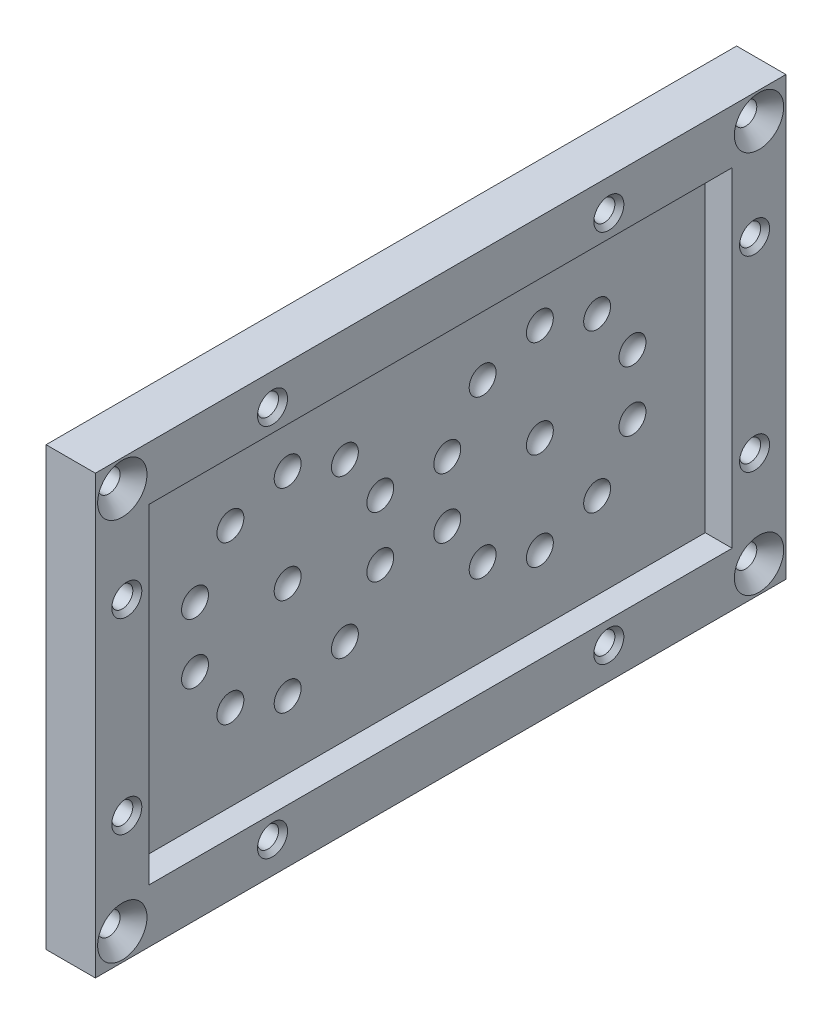
from build123d import *

# Parameters (mm, degrees)
SKETCH1_W           = 130
SKETCH1_H           = 73.5
BOSS_EXTRUDE1_DEPTH = 5
SKETCH2_R           = 3
CUT_EXTRUDE1_DEPTH  = 2
FILLET1_R           = 3.23
SKETCH3_W           = 10
SKETCH3_H           = 73.5
BOSS_EXTRUDE2_DEPTH = 11
SKETCH4_R           = 2.35
CUT_EXTRUDE2_DEPTH  = 8
CHAMFER1_SIZE       = 1
SKETCH5_W           = 11
SKETCH5_H           = 150
BOSS_EXTRUDE3_DEPTH = 2
SKETCH6_W           = 11
SKETCH6_H           = 150
BOSS_EXTRUDE4_DEPTH = 2
SKETCH7_W           = 11
SKETCH7_H           = 97.5
BOSS_EXTRUDE5_DEPTH = 2
SKETCH8_W           = 11
SKETCH8_H           = 97.5
BOSS_EXTRUDE6_DEPTH = 2
SKETCH12_R          = 2.5
CUT_EXTRUDE3_DEPTH  = 92.796309839
CHAMFER2_SIZE       = 3


with BuildPart() as part:
    # Sketch1 → Boss-Extrude1 (new body)
    with BuildSketch(Plane(origin=(0, 0, 0), x_dir=(0, 0, -1), z_dir=(1, 0, 0))):
        Rectangle(SKETCH1_W, SKETCH1_H)
    extrude(amount=BOSS_EXTRUDE1_DEPTH)

    # Sketch2 → Cut-Extrude1 (cut)
    with BuildSketch(Plane(origin=(5, 0, 0), x_dir=(0, 0, -1), z_dir=(1, 0, 0))):
        with Locations((28.125, -21.718)):
            Circle(SKETCH2_R)
        with Locations((15.359479891, -17.570231084)):
            Circle(SKETCH2_R)
        with Locations((7.469954579, -6.711231084)):
            Circle(SKETCH2_R)
        with Locations((7.469954579, 6.711231084)):
            Circle(SKETCH2_R)
        with Locations((15.359479891, 17.570231084)):
            Circle(SKETCH2_R)
        with Locations((28.125, 21.718)):
            Circle(SKETCH2_R)
        with Locations((40.890520109, 17.570231084)):
            Circle(SKETCH2_R)
        with Locations((48.780045421, 6.711231084)):
            Circle(SKETCH2_R)
        with Locations((48.780045421, -6.711231084)):
            Circle(SKETCH2_R)
        with Locations((40.890520109, -17.570231084)):
            Circle(SKETCH2_R)
        with Locations(Location((-7.469954579, -6.711231084, 0), (0, 0, 180))):
            Circle(SKETCH2_R)
        with Locations(Location((-15.359479891, -17.570231084, 0), (0, 0, 180))):
            Circle(SKETCH2_R)
        with Locations(Location((-28.125, -21.718, 0), (0, 0, 180))):
            Circle(SKETCH2_R)
        with Locations(Location((-40.890520109, -17.570231084, 0), (0, 0, 180))):
            Circle(SKETCH2_R)
        with Locations(Location((-48.780045421, -6.711231084, 0), (0, 0, 180))):
            Circle(SKETCH2_R)
        with Locations(Location((-48.780045421, 6.711231084, 0), (0, 0, 180))):
            Circle(SKETCH2_R)
        with Locations(Location((-40.890520109, 17.570231084, 0), (0, 0, 180))):
            Circle(SKETCH2_R)
        with Locations(Location((-28.125, 21.718, 0), (0, 0, 180))):
            Circle(SKETCH2_R)
        with Locations(Location((-15.359479891, 17.570231084, 0), (0, 0, 180))):
            Circle(SKETCH2_R)
        with Locations(Location((-7.469954579, 6.711231084, 0), (0, 0, 180))):
            Circle(SKETCH2_R)
        with Locations((28.125, 0)):
            Circle(SKETCH2_R)
        with Locations(Location((-28.125, 0, 0), (0, 0, 180))):
            Circle(SKETCH2_R)
    extrude(amount=-CUT_EXTRUDE1_DEPTH, mode=Mode.SUBTRACT)

    # Fillet1
    # the kernel refuses this fillet: 3.23 mm, written as the material it adds along each edge
    with BuildSketch(Plane(origin=(3, 17.570231084, 40.890520109), x_dir=(0, 0, 1), z_dir=(0, 1, 0))) as fillet1_piece_1:
        with BuildLine():
            CenterArc((0.013363095, 3.23), FILLET1_R, 270, 67.616447755)
            Line((0.013363095, 0), (0.013363095, -0.0646))
            Line((0.013363095, -0.0646), (3, -0.0646))
            Line((3, -0.0646), (3.0646, 0))
            ThreePointArc((3.0646, 0), (3.0646, 1), (3.059732738, 1.9754))
            Line((3.059732738, 1.9754), (3, 2))
        make_face()
    revolve(axis=Axis((3, 17.570231084, 40.890520109), (1, 0, 0)))
    with BuildSketch(Plane(origin=(3, 6.711231084, 48.780045421), x_dir=(0, 0, 1), z_dir=(0, 1, 0))) as fillet1_piece_2:
        with BuildLine():
            CenterArc((0.013363095, 3.23), FILLET1_R, 270, 67.616447755)
            Line((0.013363095, 0), (0.013363095, -0.0646))
            Line((0.013363095, -0.0646), (3, -0.0646))
            Line((3, -0.0646), (3.0646, 0))
            ThreePointArc((3.0646, 0), (3.0646, 1), (3.059732738, 1.9754))
            Line((3.059732738, 1.9754), (3, 2))
        make_face()
    revolve(axis=Axis((3, 6.711231084, 48.780045421), (1, 0, 0)))
    with BuildSketch(Plane(origin=(3, -6.711231084, 48.780045421), x_dir=(0, 0, 1), z_dir=(0, 1, 0))) as fillet1_piece_3:
        with BuildLine():
            CenterArc((0.013363095, 3.23), FILLET1_R, 270, 67.616447755)
            Line((0.013363095, 0), (0.013363095, -0.0646))
            Line((0.013363095, -0.0646), (3, -0.0646))
            Line((3, -0.0646), (3.0646, 0))
            ThreePointArc((3.0646, 0), (3.0646, 1), (3.059732738, 1.9754))
            Line((3.059732738, 1.9754), (3, 2))
        make_face()
    revolve(axis=Axis((3, -6.711231084, 48.780045421), (1, 0, 0)))
    with BuildSketch(Plane(origin=(3, -17.570231084, 40.890520109), x_dir=(0, 0, 1), z_dir=(0, 1, 0))) as fillet1_piece_4:
        with BuildLine():
            CenterArc((0.013363095, 3.23), FILLET1_R, 270, 67.616447755)
            Line((0.013363095, 0), (0.013363095, -0.0646))
            Line((0.013363095, -0.0646), (3, -0.0646))
            Line((3, -0.0646), (3.0646, 0))
            ThreePointArc((3.0646, 0), (3.0646, 1), (3.059732738, 1.9754))
            Line((3.059732738, 1.9754), (3, 2))
        make_face()
    revolve(axis=Axis((3, -17.570231084, 40.890520109), (1, 0, 0)))
    with BuildSketch(Plane(origin=(3, -21.718, 28.125), x_dir=(0, 0, 1), z_dir=(0, 1, 0))) as fillet1_piece_5:
        with BuildLine():
            CenterArc((0.013363095, 3.23), FILLET1_R, 270, 67.616447755)
            Line((0.013363095, 0), (0.013363095, -0.0646))
            Line((0.013363095, -0.0646), (3, -0.0646))
            Line((3, -0.0646), (3.0646, 0))
            ThreePointArc((3.0646, 0), (3.0646, 1), (3.059732738, 1.9754))
            Line((3.059732738, 1.9754), (3, 2))
        make_face()
    revolve(axis=Axis((3, -21.718, 28.125), (1, 0, 0)))
    with BuildSketch(Plane(origin=(3, -17.570231084, 15.359479891), x_dir=(0, 0, 1), z_dir=(0, 1, 0))) as fillet1_piece_6:
        with BuildLine():
            CenterArc((0.013363095, 3.23), FILLET1_R, 270, 67.616447755)
            Line((0.013363095, 0), (0.013363095, -0.0646))
            Line((0.013363095, -0.0646), (3, -0.0646))
            Line((3, -0.0646), (3.0646, 0))
            ThreePointArc((3.0646, 0), (3.0646, 1), (3.059732738, 1.9754))
            Line((3.059732738, 1.9754), (3, 2))
        make_face()
    revolve(axis=Axis((3, -17.570231084, 15.359479891), (1, 0, 0)))
    with BuildSketch(Plane(origin=(3, -17.570231084, -40.890520109), x_dir=(0, 0, -1), z_dir=(0, -1, 0))) as fillet1_piece_7:
        with BuildLine():
            CenterArc((0.013363095, 3.23), FILLET1_R, 270, 67.616447755)
            Line((0.013363095, 0), (0.013363095, -0.0646))
            Line((0.013363095, -0.0646), (3, -0.0646))
            Line((3, -0.0646), (3.0646, 0))
            ThreePointArc((3.0646, 0), (3.0646, 1), (3.059732738, 1.9754))
            Line((3.059732738, 1.9754), (3, 2))
        make_face()
    revolve(axis=Axis((3, -17.570231084, -40.890520109), (1, 0, 0)))
    with BuildSketch(Plane(origin=(3, -6.711231084, -48.780045421), x_dir=(0, 0, -1), z_dir=(0, -1, 0))) as fillet1_piece_8:
        with BuildLine():
            CenterArc((0.013363095, 3.23), FILLET1_R, 270, 67.616447755)
            Line((0.013363095, 0), (0.013363095, -0.0646))
            Line((0.013363095, -0.0646), (3, -0.0646))
            Line((3, -0.0646), (3.0646, 0))
            ThreePointArc((3.0646, 0), (3.0646, 1), (3.059732738, 1.9754))
            Line((3.059732738, 1.9754), (3, 2))
        make_face()
    revolve(axis=Axis((3, -6.711231084, -48.780045421), (1, 0, 0)))
    with BuildSketch(Plane(origin=(3, 6.711231084, -7.469954579), x_dir=(0, 0, -1), z_dir=(0, -1, 0))) as fillet1_piece_9:
        with BuildLine():
            CenterArc((0.013363095, 3.23), FILLET1_R, 270, 67.616447755)
            Line((0.013363095, 0), (0.013363095, -0.0646))
            Line((0.013363095, -0.0646), (3, -0.0646))
            Line((3, -0.0646), (3.0646, 0))
            ThreePointArc((3.0646, 0), (3.0646, 1), (3.059732738, 1.9754))
            Line((3.059732738, 1.9754), (3, 2))
        make_face()
    revolve(axis=Axis((3, 6.711231084, -7.469954579), (1, 0, 0)))
    with BuildSketch(Plane(origin=(3, -6.711231084, -7.469954579), x_dir=(0, 0, -1), z_dir=(0, -1, 0))) as fillet1_piece_10:
        with BuildLine():
            CenterArc((0.013363095, 3.23), FILLET1_R, 270, 67.616447755)
            Line((0.013363095, 0), (0.013363095, -0.0646))
            Line((0.013363095, -0.0646), (3, -0.0646))
            Line((3, -0.0646), (3.0646, 0))
            ThreePointArc((3.0646, 0), (3.0646, 1), (3.059732738, 1.9754))
            Line((3.059732738, 1.9754), (3, 2))
        make_face()
    revolve(axis=Axis((3, -6.711231084, -7.469954579), (1, 0, 0)))
    with BuildSketch(Plane(origin=(3, -17.570231084, -15.359479891), x_dir=(0, 0, -1), z_dir=(0, -1, 0))) as fillet1_piece_11:
        with BuildLine():
            CenterArc((0.013363095, 3.23), FILLET1_R, 270, 67.616447755)
            Line((0.013363095, 0), (0.013363095, -0.0646))
            Line((0.013363095, -0.0646), (3, -0.0646))
            Line((3, -0.0646), (3.0646, 0))
            ThreePointArc((3.0646, 0), (3.0646, 1), (3.059732738, 1.9754))
            Line((3.059732738, 1.9754), (3, 2))
        make_face()
    revolve(axis=Axis((3, -17.570231084, -15.359479891), (1, 0, 0)))
    with BuildSketch(Plane(origin=(3, -6.711231084, 7.469954579), x_dir=(0, 0, 1), z_dir=(0, 1, 0))) as fillet1_piece_12:
        with BuildLine():
            CenterArc((0.013363095, 3.23), FILLET1_R, 270, 67.616447755)
            Line((0.013363095, 0), (0.013363095, -0.0646))
            Line((0.013363095, -0.0646), (3, -0.0646))
            Line((3, -0.0646), (3.0646, 0))
            ThreePointArc((3.0646, 0), (3.0646, 1), (3.059732738, 1.9754))
            Line((3.059732738, 1.9754), (3, 2))
        make_face()
    revolve(axis=Axis((3, -6.711231084, 7.469954579), (1, 0, 0)))
    with BuildSketch(Plane(origin=(3, 17.570231084, -15.359479891), x_dir=(0, 0, -1), z_dir=(0, -1, 0))) as fillet1_piece_13:
        with BuildLine():
            CenterArc((0.013363095, 3.23), FILLET1_R, 270, 67.616447755)
            Line((0.013363095, 0), (0.013363095, -0.0646))
            Line((0.013363095, -0.0646), (3, -0.0646))
            Line((3, -0.0646), (3.0646, 0))
            ThreePointArc((3.0646, 0), (3.0646, 1), (3.059732738, 1.9754))
            Line((3.059732738, 1.9754), (3, 2))
        make_face()
    revolve(axis=Axis((3, 17.570231084, -15.359479891), (1, 0, 0)))
    with BuildSketch(Plane(origin=(3, 21.718, -28.125), x_dir=(0, 0, -1), z_dir=(0, -1, 0))) as fillet1_piece_14:
        with BuildLine():
            CenterArc((0.013363095, 3.23), FILLET1_R, 270, 67.616447755)
            Line((0.013363095, 0), (0.013363095, -0.0646))
            Line((0.013363095, -0.0646), (3, -0.0646))
            Line((3, -0.0646), (3.0646, 0))
            ThreePointArc((3.0646, 0), (3.0646, 1), (3.059732738, 1.9754))
            Line((3.059732738, 1.9754), (3, 2))
        make_face()
    revolve(axis=Axis((3, 21.718, -28.125), (1, 0, 0)))
    with BuildSketch(Plane(origin=(3, 17.570231084, -40.890520109), x_dir=(0, 0, -1), z_dir=(0, -1, 0))) as fillet1_piece_15:
        with BuildLine():
            CenterArc((0.013363095, 3.23), FILLET1_R, 270, 67.616447755)
            Line((0.013363095, 0), (0.013363095, -0.0646))
            Line((0.013363095, -0.0646), (3, -0.0646))
            Line((3, -0.0646), (3.0646, 0))
            ThreePointArc((3.0646, 0), (3.0646, 1), (3.059732738, 1.9754))
            Line((3.059732738, 1.9754), (3, 2))
        make_face()
    revolve(axis=Axis((3, 17.570231084, -40.890520109), (1, 0, 0)))
    with BuildSketch(Plane(origin=(3, 6.711231084, -48.780045421), x_dir=(0, 0, -1), z_dir=(0, -1, 0))) as fillet1_piece_16:
        with BuildLine():
            CenterArc((0.013363095, 3.23), FILLET1_R, 270, 67.616447755)
            Line((0.013363095, 0), (0.013363095, -0.0646))
            Line((0.013363095, -0.0646), (3, -0.0646))
            Line((3, -0.0646), (3.0646, 0))
            ThreePointArc((3.0646, 0), (3.0646, 1), (3.059732738, 1.9754))
            Line((3.059732738, 1.9754), (3, 2))
        make_face()
    revolve(axis=Axis((3, 6.711231084, -48.780045421), (1, 0, 0)))
    with BuildSketch(Plane(origin=(3, 0, 28.125), x_dir=(0, 0, 1), z_dir=(0, 1, 0))) as fillet1_piece_17:
        with BuildLine():
            CenterArc((0.013363095, 3.23), FILLET1_R, 270, 67.616447755)
            Line((0.013363095, 0), (0.013363095, -0.0646))
            Line((0.013363095, -0.0646), (3, -0.0646))
            Line((3, -0.0646), (3.0646, 0))
            ThreePointArc((3.0646, 0), (3.0646, 1), (3.059732738, 1.9754))
            Line((3.059732738, 1.9754), (3, 2))
        make_face()
    revolve(axis=Axis((3, 0, 28.125), (1, 0, 0)))
    with BuildSketch(Plane(origin=(3, 0, -28.125), x_dir=(0, 0, -1), z_dir=(0, -1, 0))) as fillet1_piece_18:
        with BuildLine():
            CenterArc((0.013363095, 3.23), FILLET1_R, 270, 67.616447755)
            Line((0.013363095, 0), (0.013363095, -0.0646))
            Line((0.013363095, -0.0646), (3, -0.0646))
            Line((3, -0.0646), (3.0646, 0))
            ThreePointArc((3.0646, 0), (3.0646, 1), (3.059732738, 1.9754))
            Line((3.059732738, 1.9754), (3, 2))
        make_face()
    revolve(axis=Axis((3, 0, -28.125), (1, 0, 0)))
    with BuildSketch(Plane(origin=(3, 6.711231084, 7.469954579), x_dir=(0, 0, 1), z_dir=(0, 1, 0))) as fillet1_piece_19:
        with BuildLine():
            CenterArc((0.013363095, 3.23), FILLET1_R, 270, 67.616447755)
            Line((0.013363095, 0), (0.013363095, -0.0646))
            Line((0.013363095, -0.0646), (3, -0.0646))
            Line((3, -0.0646), (3.0646, 0))
            ThreePointArc((3.0646, 0), (3.0646, 1), (3.059732738, 1.9754))
            Line((3.059732738, 1.9754), (3, 2))
        make_face()
    revolve(axis=Axis((3, 6.711231084, 7.469954579), (1, 0, 0)))
    with BuildSketch(Plane(origin=(3, 17.570231084, 15.359479891), x_dir=(0, 0, 1), z_dir=(0, 1, 0))) as fillet1_piece_20:
        with BuildLine():
            CenterArc((0.013363095, 3.23), FILLET1_R, 270, 67.616447755)
            Line((0.013363095, 0), (0.013363095, -0.0646))
            Line((0.013363095, -0.0646), (3, -0.0646))
            Line((3, -0.0646), (3.0646, 0))
            ThreePointArc((3.0646, 0), (3.0646, 1), (3.059732738, 1.9754))
            Line((3.059732738, 1.9754), (3, 2))
        make_face()
    revolve(axis=Axis((3, 17.570231084, 15.359479891), (1, 0, 0)))
    with BuildSketch(Plane(origin=(3, 21.718, 28.125), x_dir=(0, 0, 1), z_dir=(0, 1, 0))) as fillet1_piece_21:
        with BuildLine():
            CenterArc((0.013363095, 3.23), FILLET1_R, 270, 67.616447755)
            Line((0.013363095, 0), (0.013363095, -0.0646))
            Line((0.013363095, -0.0646), (3, -0.0646))
            Line((3, -0.0646), (3.0646, 0))
            ThreePointArc((3.0646, 0), (3.0646, 1), (3.059732738, 1.9754))
            Line((3.059732738, 1.9754), (3, 2))
        make_face()
    revolve(axis=Axis((3, 21.718, 28.125), (1, 0, 0)))
    with BuildSketch(Plane(origin=(3, -21.718, -28.125), x_dir=(0, 0, -1), z_dir=(0, -1, 0))) as fillet1_piece_22:
        with BuildLine():
            CenterArc((0.013363095, 3.23), FILLET1_R, 270, 67.616447755)
            Line((0.013363095, 0), (0.013363095, -0.0646))
            Line((0.013363095, -0.0646), (3, -0.0646))
            Line((3, -0.0646), (3.0646, 0))
            ThreePointArc((3.0646, 0), (3.0646, 1), (3.059732738, 1.9754))
            Line((3.059732738, 1.9754), (3, 2))
        make_face()
    revolve(axis=Axis((3, -21.718, -28.125), (1, 0, 0)))

    # Sketch3 → Boss-Extrude2 (add)
    with BuildSketch(Plane.ZY):
        Polygon((65, 36.75), (75, 36.75), (75, 46.75), (-75, 46.75), (-75, 36.75), (-65, 36.75), align=None)
        with Locations((70, 0)):
            Rectangle(SKETCH3_W, SKETCH3_H)
        Polygon((-65, -36.75), (-75, -36.75), (-75, -46.75), (75, -46.75), (75, -36.75), (65, -36.75), align=None)
        with Locations((-70, 0)):
            Rectangle(SKETCH3_W, SKETCH3_H)
    extrude(amount=-BOSS_EXTRUDE2_DEPTH)

    # Sketch4 → Cut-Extrude2 (cut)
    with BuildSketch(Plane(origin=(11, 0, 0), x_dir=(0, 0, -1), z_dir=(1, 0, 0))):
        with Locations((-37.5, 41.75)):
            Circle(SKETCH4_R)
        with Locations((37.5, 41.75)):
            Circle(SKETCH4_R)
        with Locations((70, 20.875)):
            Circle(SKETCH4_R)
        with Locations(Location((37.5, -41.75, 0), (0, 0, 180))):
            Circle(SKETCH4_R)
        with Locations(Location((-37.5, -41.75, 0), (0, 0, 180))):
            Circle(SKETCH4_R)
        with Locations(Location((-70, 20.875, 0), (0, 0, 180))):
            Circle(SKETCH4_R)
        with Locations((70, -20.875)):
            Circle(SKETCH4_R)
        with Locations(Location((-70, -20.875, 0), (0, 0, 180))):
            Circle(SKETCH4_R)
    extrude(amount=-CUT_EXTRUDE2_DEPTH, mode=Mode.SUBTRACT)

    # Chamfer1
    chamfer1_edges = [part.edges().sort_by_distance(p)[0] for p in [
        (11, 41.75, -35.15),
        (11, 20.875, -67.65),
        (11, -41.75, -39.85),
        (11, -41.75, 35.15),
        (11, -20.875, 67.65),
        (11, -20.875, -67.65),
        (11, 20.875, 67.65),
        (11, 41.75, 39.85),
    ]]
    chamfer(chamfer1_edges, length=CHAMFER1_SIZE)

    # Sketch5 → Boss-Extrude3 (add)
    with BuildSketch(Plane.XZ.offset(46.75)):
        with Locations((5.5, 0)):
            Rectangle(SKETCH5_W, SKETCH5_H)
    extrude(amount=BOSS_EXTRUDE3_DEPTH)

    # Sketch6 → Boss-Extrude4 (add)
    with BuildSketch(Plane(origin=(0, 46.75, 0), x_dir=(1, 0, 0), z_dir=(0, 1, 0))):
        with Locations((5.5, 0)):
            Rectangle(SKETCH6_W, SKETCH6_H)
    extrude(amount=BOSS_EXTRUDE4_DEPTH)

    # Sketch7 → Boss-Extrude5 (add)
    with BuildSketch(Plane.XY.offset(75)):
        with Locations((5.5, 0)):
            Rectangle(SKETCH7_W, SKETCH7_H)
    extrude(amount=BOSS_EXTRUDE5_DEPTH)

    # Sketch8 → Boss-Extrude6 (add)
    with BuildSketch(Plane(origin=(0, 0, -75), x_dir=(-1, 0, 0), z_dir=(0, 0, -1))):
        with Locations((-5.5, 0)):
            Rectangle(SKETCH8_W, SKETCH8_H)
    extrude(amount=BOSS_EXTRUDE6_DEPTH)

    # Sketch12 → Cut-Extrude3 (cut, through all)
    with BuildSketch(Plane(origin=(11, 0, 0), x_dir=(0, 0, -1), z_dir=(1, 0, 0))):
        with Locations((71, 42.75)):
            Circle(SKETCH12_R)
        with Locations(Location((-71, 42.75, 0), (0, 0, 180))):
            Circle(SKETCH12_R)
        with Locations(Location((71, -42.75, 0), (0, 0, 180))):
            Circle(SKETCH12_R)
        with Locations((-71, -42.75)):
            Circle(SKETCH12_R)
    extrude(amount=-CUT_EXTRUDE3_DEPTH, mode=Mode.SUBTRACT)

    # Chamfer2
    chamfer2_edges = [part.edges().sort_by_distance(p)[0] for p in [
        (11, 42.75, 68.5),
        (11, -42.75, -73.5),
        (11, -42.75, 73.5),
        (11, 42.75, -68.5),
    ]]
    chamfer(chamfer2_edges, length=CHAMFER2_SIZE)


solid = part.part
